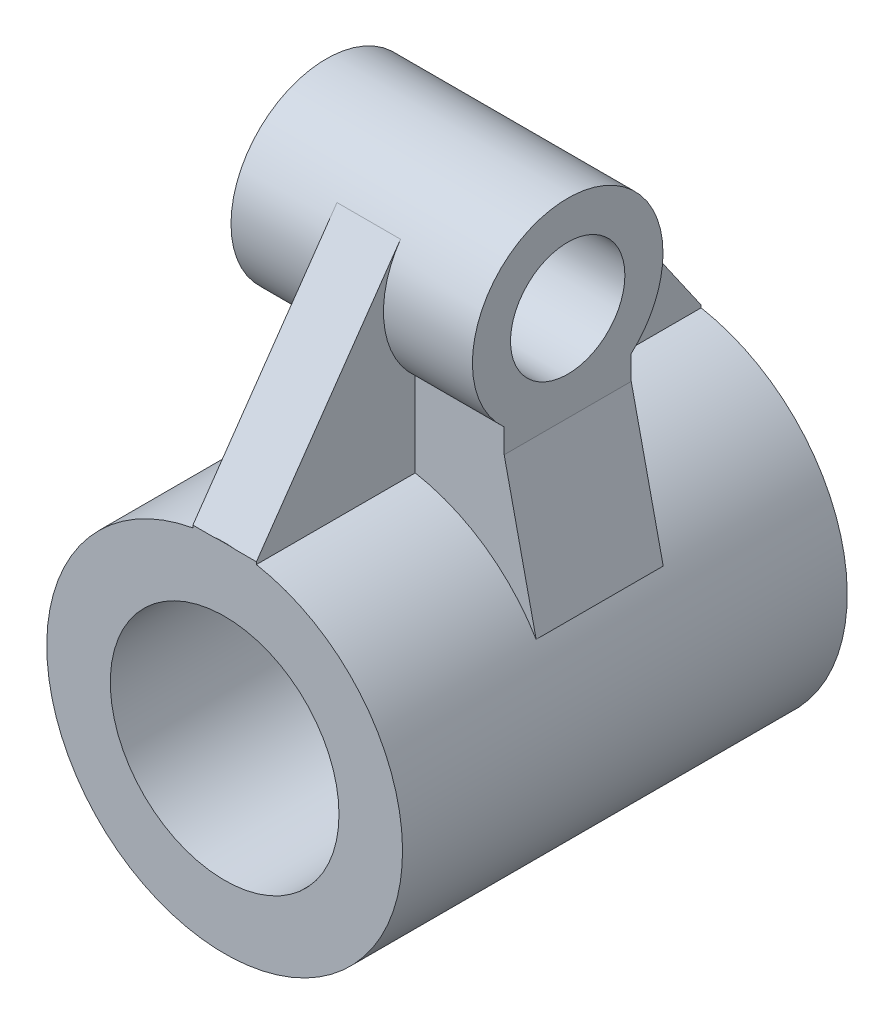
from build123d import *

# Parameters (mm, degrees)
SKETCH1_R           = 14
SKETCH1_R_2         = 9
BOSS_EXTRUDE1_DEPTH = 35
SKETCH2_R           = 7.5
SKETCH2_R_2         = 4.5
BOSS_EXTRUDE2_DEPTH = 9.5
BOSS_EXTRUDE4_DEPTH = 2.5
RIB6_START          = -5
RIB6_DEPTH          = 10


with BuildPart() as part:
    # Sketch1 → Boss-Extrude1 (new body)
    with BuildSketch(Plane.XY):
        Circle(SKETCH1_R)
        Circle(SKETCH1_R_2, mode=Mode.SUBTRACT)
    extrude(amount=-BOSS_EXTRUDE1_DEPTH)



with BuildPart() as body_2:
    # Sketch2 → Boss-Extrude2 (new, symmetric)
    with BuildSketch(Plane(origin=(0, 0, 0), x_dir=(0, 0, -1), z_dir=(1, 0, 0))):
        with Locations((17.5, 26)):
            Circle(SKETCH2_R)
        with Locations((17.5, 26)):
            Circle(SKETCH2_R_2, mode=Mode.SUBTRACT)
    extrude(amount=BOSS_EXTRUDE2_DEPTH, both=True)


with BuildPart() as part_1:
    add(part.part)

    add(body_2.part)  # Boss-Extrude4 merges body 2
    # Sketch4 → Boss-Extrude4 (add, symmetric)
    with BuildSketch(Plane(origin=(0, 0, 0), x_dir=(0, 0, -1), z_dir=(1, 0, 0))):
        with BuildLine():
            Line((11.342086503, 30.281366763), (0, 13.967981008))
            Line((0, 13.967981008), (0, 13.516905435))
            Line((0, 13.516905435), (35, 13.771632184))
            Line((35, 13.771632184), (35, 13.967981008))
            Line((35, 13.967981008), (23.657913497, 30.281366763))
            ThreePointArc((23.657913497, 30.281366763), (24.65661761, 28.243395726), (25, 26))
            ThreePointArc((25, 26), (15.256604274, 18.84338239), (11.342086503, 30.281366763))
        make_face()
    extrude(amount=BOSS_EXTRUDE4_DEPTH, both=True)

    # Rib6: read off the stored shape, not the designer's step
    # Rib6 outline → Rib6 (add)
    with BuildSketch(Plane.XY.offset(-17.5).offset(RIB6_START)):
        with BuildLine():
            Line((9.5, 20.409830056), (2.5, 20.409830056))
            Line((2.5, 20.409830056), (2.5, 13.774977314))
            ThreePointArc((2.5, 13.774977314), (7.971087724, 11.509203296), (12.016061116, 7.18430757))
            Line((12.016061116, 7.18430757), (9.5, 18.509693936))
            Line((9.5, 18.509693936), (9.5, 20.409830056))
        make_face()
    extrude(amount=RIB6_DEPTH)


solid = part_1.part
